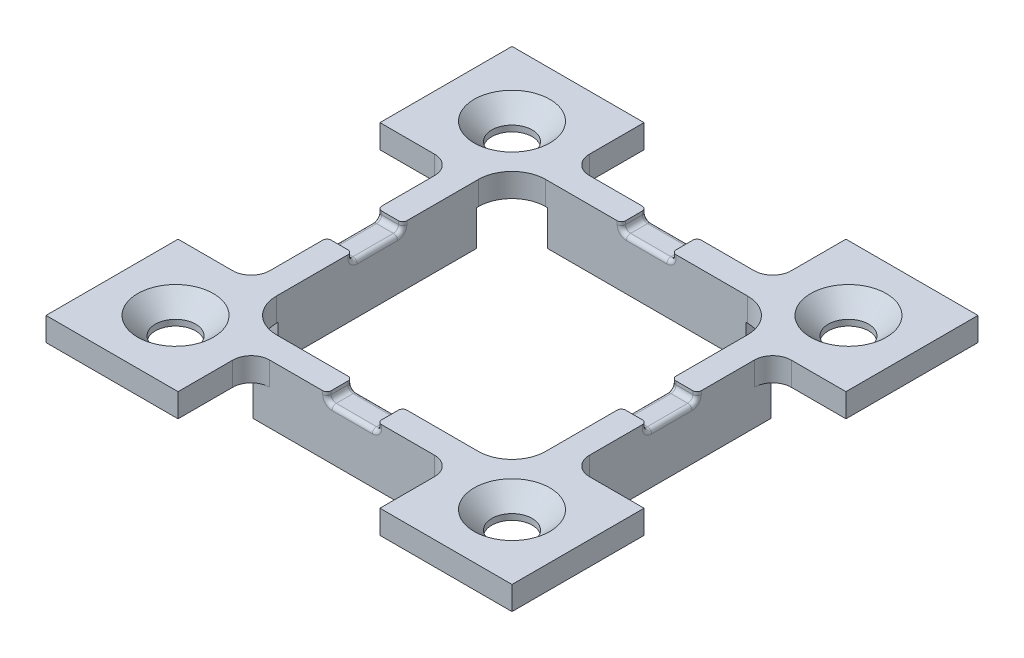
from build123d import *

# Parameters (mm, degrees)
SKETCH1_R                   = 1.2
BOSS_EXTRUDE1_DEPTH         = 1.4
SKETCH2_R                   = 2.25
CUT_EXTRUDE1_DEPTH          = 1.1
CUT_EXTRUDE1_DRAFT          = -45
SKETCH3_W                   = 12
SKETCH3_H                   = 1.5
BOSS_EXTRUDE2_DEPTH         = 3.5
CIRPATTERN1_COUNT           = 2
CIRPATTERN1_ANGLE           = 90
CIRPATTERN1_COPY_1_SKETCH_R = 2.25
CIRPATTERN1_COPY_1_DEPTH    = 1.1
CIRPATTERN1_COPY_1_DRAFT    = -45
CIRPATTERN2_START           = -14
CIRPATTERN2_OUTLINE_W       = 1.5
CIRPATTERN2_OUTLINE_H       = 3.5
CIRPATTERN2_DEPTH           = 12
CIRPATTERN2_2_OUTLINE_R     = 1.2
CIRPATTERN2_2_DEPTH         = 1.4
CIRPATTERN2_START_2         = -2.1
CIRPATTERN2_3_OUTLINE_W     = 12
CIRPATTERN2_3_OUTLINE_H     = 1.5
CIRPATTERN2_3_DEPTH         = 2.1
CIRPATTERN3_COPY_1_SKETCH_R = 2.25
CIRPATTERN3_COPY_1_DEPTH    = 1.1
CIRPATTERN3_COPY_1_DRAFT    = -45
CIRPATTERN3_COPY_2_SKETCH_R = 2.25
CIRPATTERN3_COPY_2_DEPTH    = 1.1
CIRPATTERN3_COPY_2_DRAFT    = -45
CIRPATTERN3_COPY_3_SKETCH_R = 2.25
CIRPATTERN3_COPY_3_DEPTH    = 1.1
CIRPATTERN3_COPY_3_DRAFT    = -45
CUT_EXTRUDE2_DEPTH          = 3
CIRPATTERN4_COUNT           = 4
FILLET2_R                   = 0.25
CUT_EXTRUDE3_DEPTH          = 32.183489221
CUT_EXTRUDE3_DEPTH_BACK     = 32.183489221
SKETCH5_W                   = 28
SKETCH5_H                   = 28
SKETCH5_W_2                 = 27.7
SKETCH5_H_2                 = 27.7
FILLET3_R                   = 2
FILLET4_R                   = 1.1
CUT_EXTRUDE4_DEPTH          = 31.97184205
CUT_EXTRUDE4_DEPTH_BACK     = 31.97184205
SKETCH6_W                   = 0.1
SKETCH6_H                   = 2.1
CUT_EXTRUDE5_DEPTH          = 31.97184205
CUT_EXTRUDE5_DEPTH_BACK     = 31.97184205
SKETCH7_W                   = 0.1
SKETCH7_H                   = 2.1


# Read off the part's stored shape, not the designer's step: CirPattern2
with BuildPart() as part:
    # Sketch1 → Boss-Extrude1 (new body)
    with BuildSketch(Plane(origin=(0, 0, 0), x_dir=(1, 0, 0), z_dir=(0, 1, 0))):
        Polygon((0, 0), (0, 2), (-6, 2), (-6, -6), (2, -6), (2, 0), align=None)
        with Locations(Location((-2, -2, 0), (0, 0, 270))):
            Circle(SKETCH1_R, mode=Mode.SUBTRACT)
    boss_extrude1 = extrude(amount=BOSS_EXTRUDE1_DEPTH)


with BuildPart() as cut_extrude1_tool:
    # Sketch2 → Cut-Extrude1 (with draft: the straight prism first)
    with BuildSketch(Plane(origin=(0, 1.4, 0), x_dir=(1, 0, 0), z_dir=(0, 1, 0))):
        with Locations((-2, -2)):
            Circle(SKETCH2_R)
    extrude(amount=-CUT_EXTRUDE1_DEPTH)
    # Cut-Extrude1: the draft: its side faces are tilted about the plane it starts from
    cut_extrude1_sides = [cut_extrude1_tool.faces().sort_by_distance(p)[0] for p in [
        (-4.25, 0.85, 2),
    ]]
    draft(cut_extrude1_sides, Plane(origin=(0, 1.4, 0), x_dir=(1, 0, 0), z_dir=(0, 1, 0)), CUT_EXTRUDE1_DRAFT)


with BuildPart() as part_1:
    add(part.part)

    # Cut-Extrude1: cut by cut_extrude1_tool
    add(cut_extrude1_tool.part, mode=Mode.SUBTRACT)

    # Sketch3 → Boss-Extrude2 (add)
    with BuildSketch(Plane(origin=(0, 1.4, 0), x_dir=(1, 0, 0), z_dir=(0, 1, 0))):
        with Locations((8, -0.75)):
            Rectangle(SKETCH3_W, SKETCH3_H)
    boss_extrude2 = extrude(amount=-BOSS_EXTRUDE2_DEPTH)

    # CirPattern1: Boss-Extrude1, Boss-Extrude2 ×2 about axis
    cirpattern1_axis = Axis((8, 0, -8), (0, 1, 0))
    add([boss_extrude1.rotate(cirpattern1_axis, i * CIRPATTERN1_ANGLE / (CIRPATTERN1_COUNT - 1)) for i in range(1, CIRPATTERN1_COUNT)])
    add([boss_extrude2.rotate(cirpattern1_axis, i * CIRPATTERN1_ANGLE / (CIRPATTERN1_COUNT - 1)) for i in range(1, CIRPATTERN1_COUNT)])


with BuildPart() as cirpattern1_copy_1_tool:
    # CirPattern1 copy 1 sketch → CirPattern1 copy 1 (with draft: the straight prism first)
    with BuildSketch(Plane(origin=(16, 1.4, 0), x_dir=(0, 0, -1), z_dir=(0, 1, 0))):
        with Locations((-2, -2)):
            Circle(CIRPATTERN1_COPY_1_SKETCH_R)
    extrude(amount=-CIRPATTERN1_COPY_1_DEPTH)
    # CirPattern1 copy 1: the draft: its side faces are tilted about the plane it starts from
    cirpattern1_copy_1_sides = [cirpattern1_copy_1_tool.faces().sort_by_distance(p)[0] for p in [
        (18, 0.85, 4.25),
    ]]
    draft(cirpattern1_copy_1_sides, Plane(origin=(16, 1.4, 0), x_dir=(0, 0, -1), z_dir=(0, 1, 0)), CIRPATTERN1_COPY_1_DRAFT)


with BuildPart() as part_2:
    add(part_1.part)

    # CirPattern1 copy 1: cut by cirpattern1_copy_1_tool
    add(cirpattern1_copy_1_tool.part, mode=Mode.SUBTRACT)

    # CirPattern2 outline → CirPattern2 (add)
    with BuildSketch(Plane.XY.offset(CIRPATTERN2_START)):
        with Locations((-0.75, -0.35)):
            Rectangle(CIRPATTERN2_OUTLINE_W, CIRPATTERN2_OUTLINE_H)
    extrude(amount=CIRPATTERN2_DEPTH)

    # CirPattern2 2 outline → CirPattern2 2 (add)
    with BuildSketch(Plane(origin=(0, 0, 0), x_dir=(1, 0, 0), z_dir=(0, 1, 0))):
        Polygon((2, 16), (16, 16), (16, 14), (22, 14), (22, 22), (14, 22), (14, 17.5), (2, 17.5), align=None)
        with Locations((18, 18)):
            Circle(CIRPATTERN2_2_OUTLINE_R, mode=Mode.SUBTRACT)
    extrude(amount=CIRPATTERN2_2_DEPTH)

    # CirPattern2 3 outline → CirPattern2 3 (add)
    with BuildSketch(Plane(origin=(0, 0, 0), x_dir=(1, 0, 0), z_dir=(0, 1, 0)).offset(CIRPATTERN2_START_2)):
        with Locations((8, 16.75)):
            Rectangle(CIRPATTERN2_3_OUTLINE_W, CIRPATTERN2_3_OUTLINE_H)
    extrude(amount=CIRPATTERN2_3_DEPTH)

    # CirPattern2 4 outline → CirPattern2 4 (revolve)
    with BuildSketch(Plane(origin=(18, 0, 2), x_dir=(1, 0, 0), z_dir=(0, 0, 1))):
        Polygon((1.2, 1.4), (1.2, 0.35), (2.25, 1.4), align=None)
    revolve(axis=Axis((18, 0, 2), (0, 1, 0)))

    # Mirror1: Boss-Extrude1 across plane
    add(boss_extrude1.mirror(Plane(origin=(0, 0, -8), x_dir=(1, 0, 0), z_dir=(0, 0, -1))))


with BuildPart() as cirpattern3_copy_1_tool:
    # CirPattern3 copy 1 sketch → CirPattern3 copy 1 (with draft: the straight prism first)
    with BuildSketch(Plane(origin=(16, 1.4, 0), x_dir=(0, 0, -1), z_dir=(0, 1, 0))):
        with Locations((-2, -2)):
            Circle(CIRPATTERN3_COPY_1_SKETCH_R)
    extrude(amount=-CIRPATTERN3_COPY_1_DEPTH)
    # CirPattern3 copy 1: the draft: its side faces are tilted about the plane it starts from
    cirpattern3_copy_1_sides = [cirpattern3_copy_1_tool.faces().sort_by_distance(p)[0] for p in [
        (18, 0.85, 4.25),
    ]]
    draft(cirpattern3_copy_1_sides, Plane(origin=(16, 1.4, 0), x_dir=(0, 0, -1), z_dir=(0, 1, 0)), CIRPATTERN3_COPY_1_DRAFT)


with BuildPart() as part_3:
    add(part_2.part)

    # CirPattern3 copy 1: cut by cirpattern3_copy_1_tool
    add(cirpattern3_copy_1_tool.part, mode=Mode.SUBTRACT)


with BuildPart() as cirpattern3_copy_2_tool:
    # CirPattern3 copy 2 sketch → CirPattern3 copy 2 (with draft: the straight prism first)
    with BuildSketch(Plane(origin=(16, 1.4, -16), x_dir=(-1, 0, 0), z_dir=(0, 1, 0))):
        with Locations((-2, -2)):
            Circle(CIRPATTERN3_COPY_2_SKETCH_R)
    extrude(amount=-CIRPATTERN3_COPY_2_DEPTH)
    # CirPattern3 copy 2: the draft: its side faces are tilted about the plane it starts from
    cirpattern3_copy_2_sides = [cirpattern3_copy_2_tool.faces().sort_by_distance(p)[0] for p in [
        (20.25, 0.85, -18),
    ]]
    draft(cirpattern3_copy_2_sides, Plane(origin=(16, 1.4, -16), x_dir=(-1, 0, 0), z_dir=(0, 1, 0)), CIRPATTERN3_COPY_2_DRAFT)


with BuildPart() as part_4:
    add(part_3.part)

    # CirPattern3 copy 2: cut by cirpattern3_copy_2_tool
    add(cirpattern3_copy_2_tool.part, mode=Mode.SUBTRACT)


with BuildPart() as cirpattern3_copy_3_tool:
    # CirPattern3 copy 3 sketch → CirPattern3 copy 3 (with draft: the straight prism first)
    with BuildSketch(Plane(origin=(0, 1.4, -16), x_dir=(0, 0, 1), z_dir=(0, 1, 0))):
        with Locations((-2, -2)):
            Circle(CIRPATTERN3_COPY_3_SKETCH_R)
    extrude(amount=-CIRPATTERN3_COPY_3_DEPTH)
    # CirPattern3 copy 3: the draft: its side faces are tilted about the plane it starts from
    cirpattern3_copy_3_sides = [cirpattern3_copy_3_tool.faces().sort_by_distance(p)[0] for p in [
        (-2, 0.85, -20.25),
    ]]
    draft(cirpattern3_copy_3_sides, Plane(origin=(0, 1.4, -16), x_dir=(0, 0, 1), z_dir=(0, 1, 0)), CIRPATTERN3_COPY_3_DRAFT)


with BuildPart() as part_5:
    add(part_4.part)

    # CirPattern3 copy 3: cut by cirpattern3_copy_3_tool
    add(cirpattern3_copy_3_tool.part, mode=Mode.SUBTRACT)

    # Sketch4 → Cut-Extrude2 (cut)
    with BuildSketch(Plane.XY.offset(1.5)):
        with BuildLine():
            Line((6.5, 1.4), (9.5, 1.4))
            Line((9.5, 1.4), (9.5, 1.2))
            ThreePointArc((9.5, 1.2), (9.412132034, 0.987867966), (9.2, 0.9))
            Line((9.2, 0.9), (6.8, 0.9))
            ThreePointArc((6.8, 0.9), (6.587867966, 0.987867966), (6.5, 1.2))
            Line((6.5, 1.2), (6.5, 1.4))
        make_face()
    cut_extrude2 = extrude(amount=-CUT_EXTRUDE2_DEPTH, mode=Mode.SUBTRACT)

    # CirPattern4: Cut-Extrude2 ×4 about axis
    cirpattern4_axis = Axis((8, 0, -8), (0, 1, 0))
    for i in range(1, CIRPATTERN4_COUNT):
        add(cut_extrude2.rotate(cirpattern4_axis, i * 360 / CIRPATTERN4_COUNT), mode=Mode.SUBTRACT)

    # Fillet2
    fillet2_edges = [part_5.edges().sort_by_distance(p)[0] for p in [
        (6.5, 1.3, 0),
        (9.5, 1.3, 0),
        (9.412132034, 0.987867966, 0),
        (8, 0.9, 0),
        (6.587867966, 0.987867966, 0),
        (6.5, 1.3, 1.5),
        (6.587867966, 0.987867966, 1.5),
        (8, 0.9, 1.5),
        (9.412132034, 0.987867966, 1.5),
        (9.5, 1.3, 1.5),
        (16, 1.3, -6.5),
        (16, 1.3, -9.5),
        (16, 0.987867966, -9.412132034),
        (16, 0.9, -8),
        (16, 0.987867966, -6.587867966),
        (17.5, 1.3, -6.5),
        (17.5, 0.987867966, -6.587867966),
        (17.5, 0.9, -8),
        (17.5, 0.987867966, -9.412132034),
        (17.5, 1.3, -9.5),
        (9.5, 1.3, -16),
        (6.5, 1.3, -16),
        (6.587867966, 0.987867966, -16),
        (8, 0.9, -16),
        (9.412132034, 0.987867966, -16),
        (9.5, 1.3, -17.5),
        (9.412132034, 0.987867966, -17.5),
        (8, 0.9, -17.5),
        (6.587867966, 0.987867966, -17.5),
        (6.5, 1.3, -17.5),
        (0, 1.3, -9.5),
        (0, 1.3, -6.5),
        (0, 0.987867966, -6.587867966),
        (0, 0.9, -8),
        (0, 0.987867966, -9.412132034),
        (-1.5, 1.3, -9.5),
        (-1.5, 0.987867966, -9.412132034),
        (-1.5, 0.9, -8),
        (-1.5, 0.987867966, -6.587867966),
        (-1.5, 1.3, -6.5),
    ]]
    fillet(fillet2_edges, radius=FILLET2_R)

    # Sketch5 → Cut-Extrude3 (cut, two sides: drawn at the far end of the back side and taken through both)
    with BuildSketch(Plane(origin=(0, 0, 0), x_dir=(1, 0, 0), z_dir=(0, 1, 0)).offset(-CUT_EXTRUDE3_DEPTH_BACK)):
        with Locations((8, 8)):
            Rectangle(SKETCH5_W, SKETCH5_H)
        with Locations((8, 8)):
            Rectangle(SKETCH5_W_2, SKETCH5_H_2, mode=Mode.SUBTRACT)
    extrude(amount=CUT_EXTRUDE3_DEPTH + CUT_EXTRUDE3_DEPTH_BACK, mode=Mode.SUBTRACT)

    # Fillet3
    fillet3_edges = [part_5.edges().sort_by_distance(p)[0] for p in [
        (16, 0.7, -16),
        (0, 0.7, 0),
        (0, 0.7, -16),
        (16, 0.7, 0),
    ]]
    fillet(fillet3_edges, radius=FILLET3_R)

    # Fillet4
    fillet4_edges = [part_5.edges().sort_by_distance(p)[0] for p in [
        (17.5, 0.7, -14),
        (14, 0.7, -17.5),
        (-1.5, 0.7, -2),
        (-1.5, 0.7, -14),
        (2, 0.7, -17.5),
        (2, 0.7, 1.5),
        (14, 0.7, 1.5),
        (17.5, 0.7, -2),
    ]]
    fillet(fillet4_edges, radius=FILLET4_R)

    # Sketch6 → Cut-Extrude4 (cut, two sides: drawn at the far end of the back side and taken through both)
    with BuildSketch(Plane.XY.offset(-CUT_EXTRUDE4_DEPTH_BACK)):
        with Locations((13.95, -1.05)):
            Rectangle(SKETCH6_W, SKETCH6_H)
        with Locations((2.05, -1.05)):
            Rectangle(SKETCH6_W, SKETCH6_H)
    extrude(amount=CUT_EXTRUDE4_DEPTH + CUT_EXTRUDE4_DEPTH_BACK, mode=Mode.SUBTRACT)

    # Sketch7 → Cut-Extrude5 (cut, two sides: drawn at the far end of the back side and taken through both)
    with BuildSketch(Plane(origin=(0, 0, 0), x_dir=(0, 0, -1), z_dir=(1, 0, 0)).offset(-CUT_EXTRUDE5_DEPTH_BACK)):
        with Locations((2.05, -1.05)):
            Rectangle(SKETCH7_W, SKETCH7_H)
        with Locations((13.95, -1.05)):
            Rectangle(SKETCH7_W, SKETCH7_H)
    extrude(amount=CUT_EXTRUDE5_DEPTH + CUT_EXTRUDE5_DEPTH_BACK, mode=Mode.SUBTRACT)


solid = part_5.part
